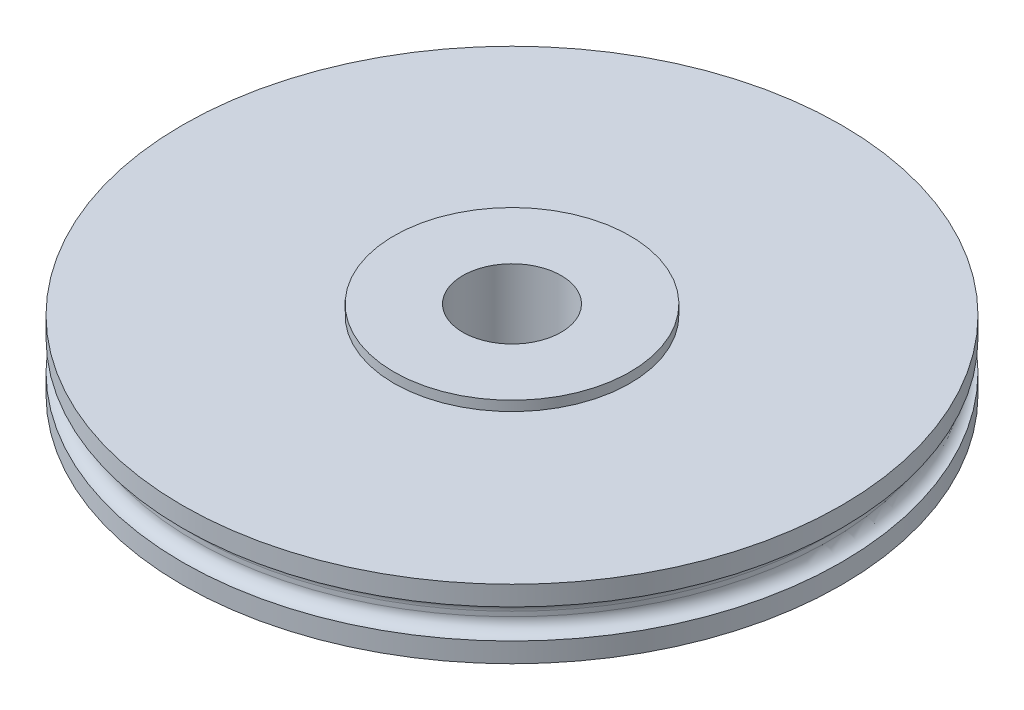
from build123d import *

# Parameters (mm, degrees)
SKETCH1_R           = 26.590625
BOSS_EXTRUDE1_DEPTH = 1.5875
SKETCH2_R           = 25.5984375
BOSS_EXTRUDE2_DEPTH = 2.38125
SKETCH3_R           = 26.590625
BOSS_EXTRUDE3_DEPTH = 1.5875
SKETCH5_R           = 9.525
BOSS_EXTRUDE4_DEPTH = 0.79375
SKETCH6_R           = 3.96875
CUT_EXTRUDE1_DEPTH  = 39.137188881
FILLET1_R           = 1
FILLET2_R           = 1


with BuildPart() as part:
    # Sketch1 → Boss-Extrude1 (new body)
    with BuildSketch(Plane(origin=(0, 0, 0), x_dir=(1, 0, 0), z_dir=(0, 1, 0))):
        with Locations(Location((0, 0, 0), (0, 0, 270))):
            Circle(SKETCH1_R)
    extrude(amount=BOSS_EXTRUDE1_DEPTH)

    # Sketch2 → Boss-Extrude2 (add)
    with BuildSketch(Plane(origin=(0, 1.5875, 0), x_dir=(1, 0, 0), z_dir=(0, 1, 0))):
        with Locations(Location((0, 0, 0), (0, 0, 90))):
            Circle(SKETCH2_R)
    extrude(amount=BOSS_EXTRUDE2_DEPTH)

    # Sketch3 → Boss-Extrude3 (add)
    with BuildSketch(Plane(origin=(0, 3.96875, 0), x_dir=(1, 0, 0), z_dir=(0, 1, 0))):
        with Locations(Location((0, 0, 0), (0, 0, 270))):
            Circle(SKETCH3_R)
    extrude(amount=BOSS_EXTRUDE3_DEPTH)

    # Sketch5 → Boss-Extrude4 (add)
    with BuildSketch(Plane(origin=(0, 5.55625, 0), x_dir=(1, 0, 0), z_dir=(0, 1, 0))):
        with Locations(Location((0, 0, 0), (0, 0, 270))):
            Circle(SKETCH5_R)
    extrude(amount=BOSS_EXTRUDE4_DEPTH)

    # Sketch6 → Cut-Extrude1 (cut, through all)
    with BuildSketch(Plane(origin=(0, 6.35, 0), x_dir=(1, 0, 0), z_dir=(0, 1, 0))):
        with Locations(Location((0, 0, 0), (0, 0, 270))):
            Circle(SKETCH6_R)
    extrude(amount=-CUT_EXTRUDE1_DEPTH, mode=Mode.SUBTRACT)

    # Fillet1
    # the kernel refuses this fillet: 1 mm, written as the material it adds along each edge
    with BuildSketch(Plane(origin=(0, 1.5875, 0), x_dir=(0, 0, -1), z_dir=(1, 0, 0))) as fillet1_piece_1_section:
        with BuildLine():
            CenterArc((25.5984375 + FILLET1_R, FILLET1_R), FILLET1_R, 180, 90)
            Line((25.5984375 + FILLET1_R, 0), (25.5984375, 0))
            Line((25.5984375, 0), (25.5984375, FILLET1_R))
        make_face()
    fillet1_piece_1 = revolve(axis=Axis((0, 1.5875, 0), (0, 1, 0)), mode=Mode.PRIVATE)
    fillet1_piece_1 = fillet1_piece_1 & Plane(origin=(0, 1.858804506, 0), x_dir=(0, 0, 1), z_dir=(0, -1, 0)) * Cylinder(26.590625, 107, mode=Mode.PRIVATE)
    add(fillet1_piece_1)

    # Fillet2
    # the kernel refuses this fillet: 1 mm, written as the material it adds along each edge
    with BuildSketch(Plane(origin=(0, 3.96875, 0), x_dir=(0, 0, -1), z_dir=(1, 0, 0))) as fillet2_piece_1_section:
        with BuildLine():
            CenterArc((25.5984375 + FILLET2_R, -FILLET2_R), FILLET2_R, 90, 90)
            Line((25.5984375 + FILLET2_R, 0), (25.5984375, 0))
            Line((25.5984375, 0), (25.5984375, -FILLET2_R))
        make_face()
    fillet2_piece_1 = revolve(axis=Axis((0, 3.96875, 0), (0, 1, 0)), mode=Mode.PRIVATE)
    fillet2_piece_1 = fillet2_piece_1 & Plane(origin=(0, 3.697445494, 0), x_dir=(0, 0, 1), z_dir=(0, -1, 0)) * Cylinder(26.590625, 107, mode=Mode.PRIVATE)
    add(fillet2_piece_1)


solid = part.part
